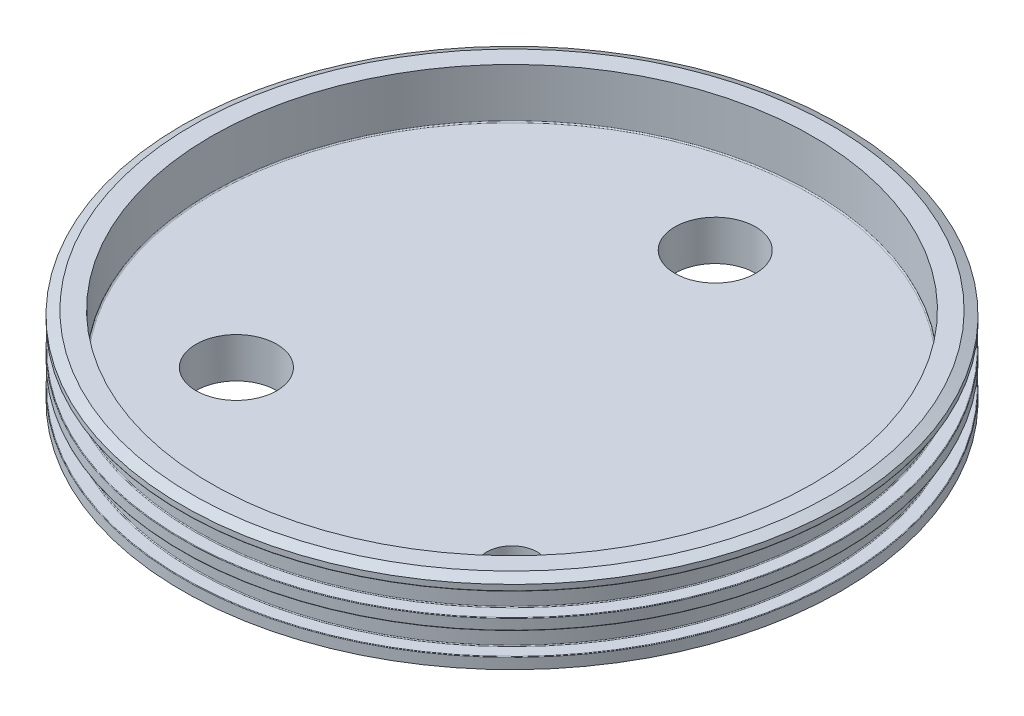
from build123d import *

# Parameters (mm, degrees)
SKETCH6_R                                = 66.04
BOSS_EXTRUDE1_DEPTH                      = 2.54
CNC_ID_FILLET_R                          = 0.1778
CNC_OD_FILLET_R                          = 0.127
CNC_CHAMFERS_SIZE                        = 1.016
CNC_CHAMFERS_SIZE2                       = 2.178819031
CNC_BORE_FILLET_R                        = 0.254
PIPE_TAP_DRILL_FOR_1_2_TAP_FILL_VALVE_D  = 17.8562
PIPE_TAP_DRILL_FOR_1_4_TAP_SOLENOID_VA_D = 11.1252
PIPE_TAP_DRILL_FOR_1_2_TAP_CRYO_VALVE_D  = 17.8562


with BuildPart() as part:
    # Sketch1 → Revolve1 (revolve)
    with BuildSketch(Plane.XY):
        Polygon((0, 0), (72.898, 0), (72.898, 2.4638), (69.977, 2.4638), (69.977, 7.4422), (72.898, 7.4422), (72.898, 9.906), (69.977, 9.906), (69.977, 14.986), (72.898, 14.986), (72.898, 17.3482), (66.548, 17.3482), (66.548, 6.35), (0, 6.35), align=None)
    revolve(axis=Axis((0, 48.192213231, 0), (0, -1, 0)))

    # Sketch6 → Boss-Extrude1 (add)
    with BuildSketch(Plane.XZ):
        Circle(SKETCH6_R)
    extrude(amount=BOSS_EXTRUDE1_DEPTH)

    # CNC ID Fillet
    cnc_id_fillet_edges = [part.edges().sort_by_distance(p)[0] for p in [
        (-69.977, 7.4422, 0),
        (-69.977, 2.4638, 0),
        (-66.04, 0, 0),
        (-69.977, 14.986, 0),
        (-69.977, 9.906, 0),
    ]]
    fillet(cnc_id_fillet_edges, radius=CNC_ID_FILLET_R)

    # CNC OD Fillet
    cnc_od_fillet_edges = [part.edges().sort_by_distance(p)[0] for p in [
        (-72.898, 7.4422, 0),
        (-72.898, 2.4638, 0),
        (-72.898, 9.906, 0),
        (-72.898, 14.986, 0),
        (-66.04, -2.54, 0),
    ]]
    fillet(cnc_od_fillet_edges, radius=CNC_OD_FILLET_R)

    # CNC Chamfers
    cnc_chamfers_edges = [part.edges().sort_by_distance(p)[0] for p in [
        (-72.898, 17.3482, 0),
    ]]
    cnc_chamfers_side = [part.faces().sort_by_distance(p)[0] for p in [
        (-72.898, 16.2306, 0),
    ]]
    chamfer(cnc_chamfers_edges, length=CNC_CHAMFERS_SIZE, length2=CNC_CHAMFERS_SIZE2, reference=cnc_chamfers_side[0])

    # CNC Bore Fillet
    cnc_bore_fillet_edges = [part.edges().sort_by_distance(p)[0] for p in [
        (-66.548, 6.35, 0),
    ]]
    fillet(cnc_bore_fillet_edges, radius=CNC_BORE_FILLET_R)

    # Pipe Tap Drill for 1/2 Tap - Fill Valve (through all)
    with Locations(Plane(origin=(0, -2.54, 0), x_dir=(-1, 0, 0), z_dir=(0, -1, 0))):
        with Locations((0, 44.958)):
            Hole(PIPE_TAP_DRILL_FOR_1_2_TAP_FILL_VALVE_D / 2)

    # Pipe Tap Drill for 1/4 Tap - Solenoid Valve (through all)
    with Locations(Plane(origin=(0, -2.54, 0), x_dir=(-1, 0, 0), z_dir=(0, -1, 0))):
        with Locations((-38.1, -38.1)):
            Hole(PIPE_TAP_DRILL_FOR_1_4_TAP_SOLENOID_VA_D / 2)

    # Pipe Tap Drill for 1/2 Tap - Cryo Valve (through all)
    with Locations(Plane(origin=(0, -2.54, 0), x_dir=(-1, 0, 0), z_dir=(0, -1, 0))):
        with Locations((30.48, -30.48)):
            Hole(PIPE_TAP_DRILL_FOR_1_2_TAP_CRYO_VALVE_D / 2)


solid = part.part
